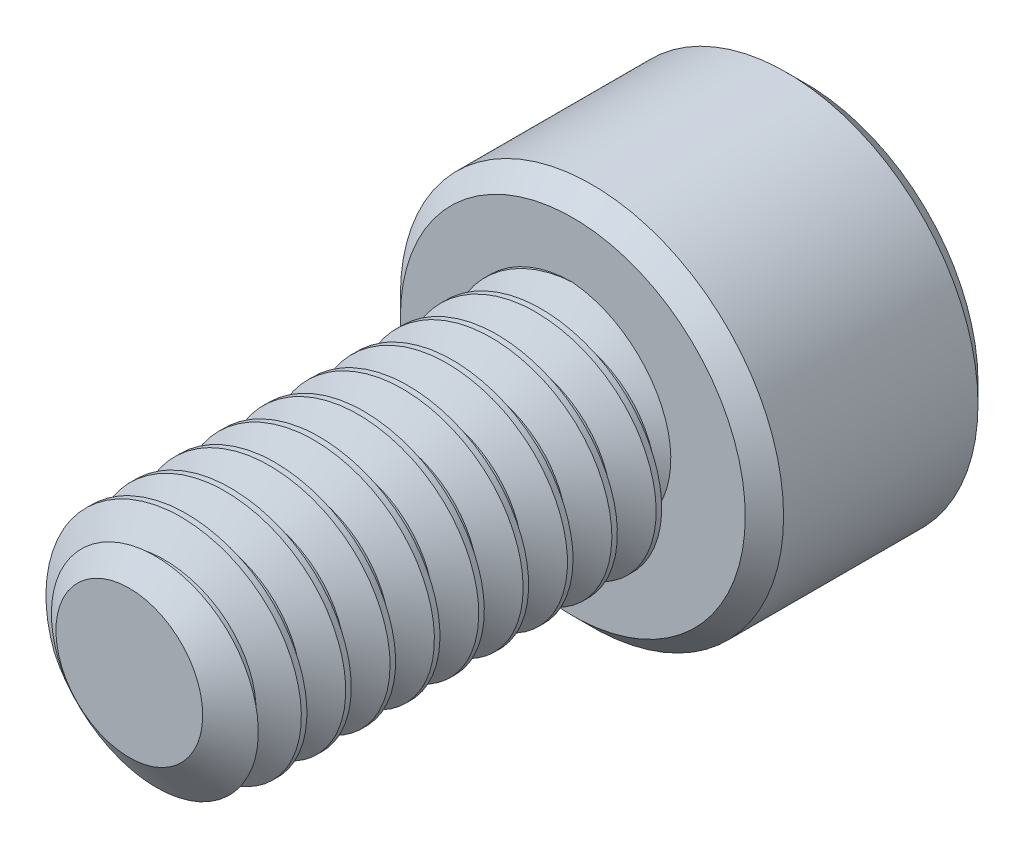
from build123d import *

# Parameters (mm, degrees)
SKETCH1_R          = 2.0828
EXTRUDE1_DEPTH     = 7.9375
CUT_SWEEP1_PITCH   = 0.79375
SKETCH6_R          = 3.429
EXTRUDE2_DEPTH     = 4.1656
CUT_EXTRUDE1_DEPTH = 2.67890625
CHAMFER1_SIZE      = 0.3429


with BuildPart() as part:
    # Sketch1 → Extrude1 (new body)
    with BuildSketch(Plane.XY):
        Circle(SKETCH1_R)
    extrude(amount=-EXTRUDE1_DEPTH)

    # Cut-Sweep1: the profile of Sketch3 profile screwed along a right-hand helix of 11 turns, 6 arcs to a turn; built about Z, then put on its axis
    cut_sweep1_z = Axis((0, 0, 0), (0, 0, 1))
    cut_sweep1_corners = [(2.0831, 0, -0.694704455), (1.567244252, 0, -0.396875), (1.567244252, 0, -0.29765625), (2.0831, 0, 0.000173205)]
    with BuildLine(mode=Mode.PRIVATE) as cut_sweep1_profile:
        Line(cut_sweep1_corners[0], cut_sweep1_corners[1])
        Line(cut_sweep1_corners[1], cut_sweep1_corners[2])
        Line(cut_sweep1_corners[2], cut_sweep1_corners[3])
        Line(cut_sweep1_corners[3], cut_sweep1_corners[0])
    cut_sweep1_cap = Face(cut_sweep1_profile.wire())
    cut_sweep1_turn_angles = [0, 30, 60, 90, 120, 150, 180, 210, 240, 270, 300, 330, 360]
    cut_sweep1_turn_weights = [1, 0.8660254037844387, 1, 0.8660254037844387, 1, 0.8660254037844387, 1, 0.8660254037844387, 1, 0.8660254037844387, 1, 0.8660254037844387, 1]
    cut_sweep1_turn_rails = [Edge.make_bspline([Vector(p[0], p[1], 0).rotate(cut_sweep1_z, cut_sweep1_turn_angles[k]) / cut_sweep1_turn_weights[k] + Vector(0, 0, p[2] + CUT_SWEEP1_PITCH * cut_sweep1_turn_angles[k] / 360) for k in range(13)], [0, 0, 0, 1, 1, 2, 2, 3, 3, 4, 4, 5, 5, 6, 6, 6], 2, cut_sweep1_turn_weights) for p in cut_sweep1_corners]
    cut_sweep1_turn_sides = [Face.make_surface_from_curves(cut_sweep1_turn_rails[p[0]], cut_sweep1_turn_rails[p[1]]) for p in [(0, 1), (1, 2), (2, 3), (3, 0)]]
    cut_sweep1 = Plane(origin=(0, 0, 0), x_dir=(0, 1, 0), z_dir=(0, 0, -1)) * Solid(Shell([*[p.moved(Location((0, 0, CUT_SWEEP1_PITCH * i))) for i in range(11) for p in cut_sweep1_turn_sides], cut_sweep1_cap, cut_sweep1_cap.rotate(cut_sweep1_z, 3960).moved(Location((0, 0, CUT_SWEEP1_PITCH * 3960 / 360)))]))
    add(cut_sweep1, mode=Mode.SUBTRACT)

    # Sketch4 → Cut-Revolve1 (revolve, cut)
    with BuildSketch(Plane(origin=(0, 0, 0), x_dir=(0, 0, -1), z_dir=(1, 0, 0)), mode=Mode.PRIVATE) as cut_revolve1_sk:
        Polygon((0.538848736, 2.0828), (0, 1.313244252), (0, 2.0828), align=None)
    revolve(cut_revolve1_sk.sketch.rotate(Axis((0, 0, 0), (0, 0, -1)), 261.048315518), axis=Axis((0, 0, 0), (0, 0, -1)), mode=Mode.SUBTRACT)

    # Sketch6 → Extrude2 (add)
    with BuildSketch(Plane(origin=(0, 0, -7.9375), x_dir=(-1, 0, 0), z_dir=(0, 0, -1))):
        Circle(SKETCH6_R)
    extrude(amount=EXTRUDE2_DEPTH)

    # Sketch7 → Cut-Extrude1 (cut)
    with BuildSketch(Plane(origin=(0, 0, -12.1031), x_dir=(-1, 0, 0), z_dir=(0, 0, -1))):
        Polygon((0, 2.062222993), (-1.7859375, 1.031111496), (-1.7859375, -1.031111496), (0, -2.062222993), (1.7859375, -1.031111496), (1.7859375, 1.031111496), align=None)
    extrude(amount=-CUT_EXTRUDE1_DEPTH, mode=Mode.SUBTRACT)

    # Cut-Extrude2 cone 1 section (through the dimple's axis) → Cut-Extrude2 (revolve, cut)
    with BuildSketch(Plane(origin=(0, 0, -12.1031), x_dir=(0, 1, 0), z_dir=(1, 0, 0))):
        Polygon((0, 0), (2.062222993, 0), (0, 2.062222993), align=None)
    revolve(axis=Axis((0, 0, -12.1031), (0, 0, 1)), mode=Mode.SUBTRACT)

    # Chamfer1
    chamfer1_edges = [part.edges().sort_by_distance(p)[0] for p in [
        (3.429, 0, -7.9375),
        (3.429, 0, -12.1031),
    ]]
    chamfer(chamfer1_edges, length=CHAMFER1_SIZE)


solid = part.part
